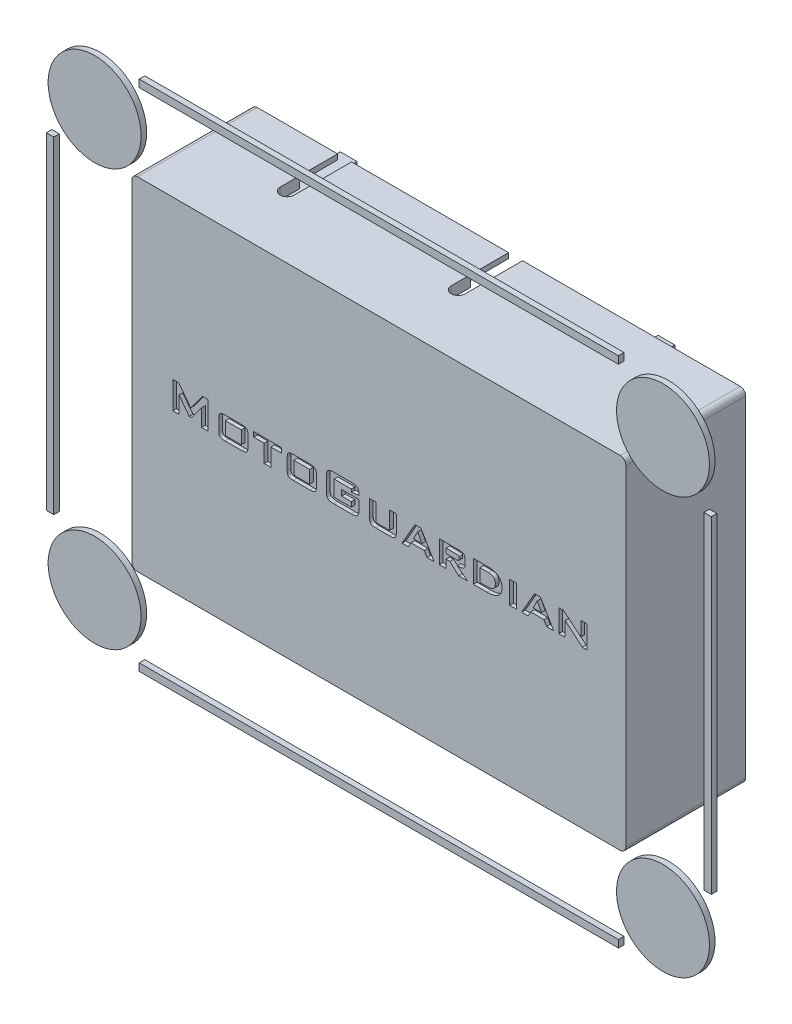
from build123d import *

# Parameters (mm, degrees)
SKETCH2_W                   = 132.9
SKETCH2_H                   = 92
BOSS_EXTRUDE1_DEPTH         = 32.25
SHELL1_T                    = -3
SKETCH3_W                   = 126.9
SKETCH3_H                   = 10.2
CUT_EXTRUDE1_DEPTH          = 1.6
SKETCH4_W                   = 10.2
SKETCH4_H                   = 87.6
CUT_EXTRUDE2_DEPTH          = 1.6
SKETCH5_W                   = 128.5
SKETCH5_H                   = 10.2
CUT_EXTRUDE3_DEPTH          = 1.6
SKETCH6_W                   = 10.2
SKETCH6_H                   = 89.2
CUT_EXTRUDE4_DEPTH          = 1.6
FILLET1_R                   = 1.5
BOSS_EXTRUDE2_DEPTH         = 19.05
BOSS_EXTRUDE3_DEPTH         = 19.05
FILLET2_R                   = 1.5
BOSS_EXTRUDE4_DEPTH         = 38.1
CUT_EXTRUDE6_DEPTH          = 3
BOSS_EXTRUDE5_DEPTH         = 16.7
BOSS_EXTRUDE6_DEPTH         = 3
SKETCH17_W                  = 15.8
SKETCH17_H                  = 1.6
BOSS_EXTRUDE8_DEPTH         = 10.2
BOSS_EXTRUDE9_START         = -1
BOSS_EXTRUDE9_OUTLINE_W     = 4.247149979
BOSS_EXTRUDE9_OUTLINE_H     = 3.474940892
BOSS_EXTRUDE9_OUTLINE_W_2   = 4.24714998
BOSS_EXTRUDE9_OUTLINE_W_3   = 1.801821204
BOSS_EXTRUDE9_OUTLINE_H_2   = 6.048971183
BOSS_EXTRUDE9_DEPTH         = 1
BOSS_EXTRUDE9_START_2       = -1.5
BOSS_EXTRUDE9_2_OUTLINE_W   = 128.9
BOSS_EXTRUDE9_2_OUTLINE_H   = 2
BOSS_EXTRUDE9_2_OUTLINE_W_2 = 2
BOSS_EXTRUDE9_2_OUTLINE_H_2 = 88
BOSS_EXTRUDE9_2_OUTLINE_R   = 12.5
BOSS_EXTRUDE9_2_DEPTH       = 1.5


# Read off the part's stored shape, not the designer's step: Boss-Extrude9
with BuildPart() as part:
    # Sketch2 → Boss-Extrude1 (new body)
    with BuildSketch(Plane.XY):
        with Locations((25.978833398, -20.101705272)):
            Rectangle(SKETCH2_W, SKETCH2_H)
    extrude(amount=BOSS_EXTRUDE1_DEPTH)

    # Shell1
    shell1_openings = [part.faces().sort_by_distance(p)[0] for p in [
        (25.978833398, -20.101705272, 0),
    ]]
    offset(amount=SHELL1_T, openings=shell1_openings, kind=Kind.INTERSECTION)

    # Sketch3 → Cut-Extrude1 (cut)
    with BuildSketch(Plane.XZ.offset(-22.898294728)):
        with Locations((25.978833398, 5.1)):
            Rectangle(SKETCH3_W, SKETCH3_H)
    extrude(amount=-CUT_EXTRUDE1_DEPTH, mode=Mode.SUBTRACT)

    # Sketch4 → Cut-Extrude2 (cut)
    with BuildSketch(Plane(origin=(-37.471166602, 0, 0), x_dir=(0, 0, -1), z_dir=(1, 0, 0))):
        with Locations((-5.1, -19.301705272)):
            Rectangle(SKETCH4_W, SKETCH4_H)
    extrude(amount=-CUT_EXTRUDE2_DEPTH, mode=Mode.SUBTRACT)

    # Sketch5 → Cut-Extrude3 (cut)
    with BuildSketch(Plane(origin=(0, -63.101705272, 0), x_dir=(1, 0, 0), z_dir=(0, 1, 0))):
        with Locations((25.178833398, -5.1)):
            Rectangle(SKETCH5_W, SKETCH5_H)
    extrude(amount=-CUT_EXTRUDE3_DEPTH, mode=Mode.SUBTRACT)

    # Sketch6 → Cut-Extrude4 (cut)
    with BuildSketch(Plane.ZY.offset(-89.428833398)):
        with Locations((5.1, -20.101705272)):
            Rectangle(SKETCH6_W, SKETCH6_H)
    extrude(amount=-CUT_EXTRUDE4_DEPTH, mode=Mode.SUBTRACT)

    # Fillet1
    fillet1_edges = [part.edges().sort_by_distance(p)[0] for p in [
        (-37.471166602, 22.898294728, 19.725),
        (-37.471166602, -63.101705272, 19.725),
        (89.428833398, -63.101705272, 19.725),
        (89.428833398, 22.898294728, 19.725),
        (-37.471166602, -20.101705272, 29.25),
        (25.978833398, -63.101705272, 29.25),
        (25.978833398, 22.898294728, 29.25),
        (-39.071166602, 24.498294728, 5.1),
        (-39.071166602, -64.701705272, 5.1),
        (91.028833398, 24.498294728, 5.1),
        (91.028833398, -64.701705272, 5.1),
        (-40.471166602, 25.898294728, 16.125),
        (92.428833398, 25.898294728, 16.125),
        (92.428833398, -66.101705272, 16.125),
        (-40.471166602, -66.101705272, 16.125),
    ]]
    fillet(fillet1_edges, radius=FILLET1_R)

    # Sketch7 → Boss-Extrude2 (add)
    with BuildSketch(Plane(origin=(0, 0, 29.25), x_dir=(-1, 0, 0), z_dir=(0, 0, -1))):
        with BuildLine():
            Line((20.971166602, 14.898294728), (20.971166602, 22.898294728))
            Line((20.971166602, 22.898294728), (28.471166602, 22.898294728))
            Line((28.471166602, 22.898294728), (28.471166602, 17.898294728))
            ThreePointArc((28.471166602, 17.898294728), (28.91050643, 16.837634557), (29.971166602, 16.398294728))
            Line((29.971166602, 16.398294728), (40.471166602, 16.398294728))
            Line((40.471166602, 16.398294728), (40.471166602, 13.398294728))
            Line((40.471166602, 13.398294728), (35.971166602, 13.398294728))
            Line((35.971166602, 13.398294728), (22.471166602, 13.398294728))
            ThreePointArc((22.471166602, 13.398294728), (21.41050643, 13.837634557), (20.971166602, 14.898294728))
        make_face()
        with BuildLine():
            Line((-68.178833398, 22.898294728), (-68.178833398, 13.398294728))
            Line((-68.178833398, 13.398294728), (-61.528833398, 13.398294728))
            ThreePointArc((-61.528833398, 13.398294728), (-60.468173226, 13.837634557), (-60.028833398, 14.898294728))
            Line((-60.028833398, 14.898294728), (-60.028833398, 22.898294728))
            Line((-60.028833398, 22.898294728), (-68.178833398, 22.898294728))
        make_face()
        with BuildLine():
            Line((20.971166602, -49.101705272), (20.971166602, -63.101705272))
            Line((20.971166602, -63.101705272), (28.471166602, -63.101705272))
            Line((28.471166602, -63.101705272), (28.471166602, -52.101705272))
            ThreePointArc((28.471166602, -52.101705272), (28.91050643, -51.0410451), (29.971166602, -50.601705272))
            Line((29.971166602, -50.601705272), (37.471166602, -50.601705272))
            Line((37.471166602, -50.601705272), (37.471166602, -47.601705272))
            Line((37.471166602, -47.601705272), (22.471166602, -47.601705272))
            ThreePointArc((22.471166602, -47.601705272), (21.41050643, -48.0410451), (20.971166602, -49.101705272))
        make_face()
        with BuildLine():
            Line((-61.528833398, -47.601705272), (-68.178833398, -47.601705272))
            Line((-68.178833398, -47.601705272), (-68.178833398, -63.101705272))
            Line((-68.178833398, -63.101705272), (-60.028833398, -63.101705272))
            Line((-60.028833398, -63.101705272), (-60.028833398, -49.101705272))
            ThreePointArc((-60.028833398, -49.101705272), (-60.468173226, -48.0410451), (-61.528833398, -47.601705272))
        make_face()
    extrude(amount=BOSS_EXTRUDE2_DEPTH)

    # Sketch8 → Boss-Extrude3 (add)
    with BuildSketch(Plane(origin=(0, 0, 29.25), x_dir=(-1, 0, 0), z_dir=(0, 0, -1))):
        Polygon((-89.428833398, 15.468294728), (-70.178833398, 15.468294728), (-70.178833398, -55.671705272), (-89.428833398, -55.671705272), (-89.428833398, -63.101705272), (-68.178833398, -63.101705272), (-68.178833398, 22.898294728), (-89.428833398, 22.898294728), align=None)
    extrude(amount=BOSS_EXTRUDE3_DEPTH)

    # Fillet2
    fillet2_edges = [part.edges().sort_by_distance(p)[0] for p in [
        (-37.031826774, 13.398294728, 28.810660172),
        (-37.031826774, 16.398294728, 28.810660172),
        (-28.471166602, 22.4589549, 28.810660172),
        (-20.971166602, 22.4589549, 28.810660172),
        (-20.971166602, 22.898294728, 18.975),
        (-20.971166602, 18.148294728, 29.25),
        (-28.471166602, 22.898294728, 18.975),
        (-28.471166602, 19.648294728, 29.25),
        (-37.471166602, 16.398294728, 18.975),
        (-37.471166602, 13.398294728, 18.975),
        (-28.91050643, 16.837634557, 29.25),
        (-32.971166602, 16.398294728, 29.25),
        (-29.221166602, 13.398294728, 29.25),
        (-21.41050643, 13.837634557, 29.25),
        (60.028833398, 18.148294728, 29.25),
        (60.028833398, 22.4589549, 28.810660172),
        (60.028833398, 22.898294728, 18.975),
        (60.468173226, 13.837634557, 29.25),
        (68.178833398, 13.398294728, 19.725),
        (64.853833398, 13.398294728, 29.25),
        (-20.971166602, -62.662365443, 28.810660172),
        (-28.471166602, -62.662365443, 28.810660172),
        (-37.471166602, -47.601705272, 18.975),
        (-37.031826774, -47.601705272, 28.810660172),
        (-29.221166602, -47.601705272, 29.25),
        (-37.471166602, -50.601705272, 18.975),
        (-32.971166602, -50.601705272, 29.25),
        (-37.031826774, -50.601705272, 28.810660172),
        (-28.471166602, -63.101705272, 18.975),
        (-28.471166602, -56.851705272, 29.25),
        (-20.971166602, -63.101705272, 18.975),
        (-20.971166602, -55.351705272, 29.25),
        (-28.91050643, -51.0410451, 29.25),
        (-21.41050643, -48.0410451, 29.25),
        (60.028833398, -63.101705272, 18.975),
        (60.028833398, -62.662365443, 28.810660172),
        (60.028833398, -55.351705272, 29.25),
        (68.178833398, -47.601705272, 19.725),
        (64.853833398, -47.601705272, 29.25),
        (60.468173226, -48.0410451, 29.25),
        (68.178833398, -17.101705272, 29.25),
    ]]
    fillet(fillet2_edges, radius=FILLET2_R)

    # Sketch11 → Boss-Extrude4 (add)
    with BuildSketch(Plane(origin=(0, 0, 29.25), x_dir=(-1, 0, 0), z_dir=(0, 0, -1))):
        with BuildLine():
            Line((25.471166602, 17.898294728), (20.971166602, 17.898294728))
            Line((20.971166602, 17.898294728), (20.971166602, 14.898294728))
            ThreePointArc((20.971166602, 14.898294728), (21.41050643, 13.837634557), (22.471166602, 13.398294728))
            Line((22.471166602, 13.398294728), (25.471166602, 13.398294728))
            Line((25.471166602, 13.398294728), (25.471166602, 17.898294728))
        make_face()
        with BuildLine():
            Line((-64.528833398, 17.898294728), (-64.528833398, 13.398294728))
            Line((-64.528833398, 13.398294728), (-61.528833398, 13.398294728))
            ThreePointArc((-61.528833398, 13.398294728), (-60.468173226, 13.837634557), (-60.028833398, 14.898294728))
            Line((-60.028833398, 14.898294728), (-60.028833398, 17.898294728))
            Line((-60.028833398, 17.898294728), (-64.528833398, 17.898294728))
        make_face()
        with BuildLine():
            Line((-64.528833398, -52.101705272), (-64.528833398, -47.601705272))
            Line((-64.528833398, -47.601705272), (-61.528833398, -47.601705272))
            ThreePointArc((-61.528833398, -47.601705272), (-60.468173226, -48.0410451), (-60.028833398, -49.101705272))
            Line((-60.028833398, -49.101705272), (-60.028833398, -52.101705272))
            Line((-60.028833398, -52.101705272), (-64.528833398, -52.101705272))
        make_face()
        with BuildLine():
            Line((25.471166602, -52.101705272), (20.971166602, -52.101705272))
            Line((20.971166602, -52.101705272), (20.971166602, -49.101705272))
            ThreePointArc((20.971166602, -49.101705272), (21.41050643, -48.0410451), (22.471166602, -47.601705272))
            Line((22.471166602, -47.601705272), (25.471166602, -47.601705272))
            Line((25.471166602, -47.601705272), (25.471166602, -52.101705272))
        make_face()
    extrude(amount=BOSS_EXTRUDE4_DEPTH)

    # Sketch13 → Cut-Extrude6 (cut)
    with BuildSketch(Plane(origin=(0, 25.898294728, 0), x_dir=(1, 0, 0), z_dir=(0, 1, 0))):
        with BuildLine():
            Line((32.403833398, -15.45), (32.403833398, 0))
            Line((32.403833398, 0), (28.653833398, 0))
            Line((28.653833398, 0), (28.653833398, -15.45))
            ThreePointArc((28.653833398, -15.45), (30.528833398, -17.325), (32.403833398, -15.45))
        make_face()
        with BuildLine():
            Line((-13.596166602, -15.45), (-13.596166602, 0))
            Line((-13.596166602, 0), (-17.346166602, 0))
            Line((-17.346166602, 0), (-17.346166602, -15.45))
            ThreePointArc((-17.346166602, -15.45), (-15.471166602, -17.325), (-13.596166602, -15.45))
        make_face()
    extrude(amount=-CUT_EXTRUDE6_DEPTH, mode=Mode.SUBTRACT)

    # Sketch14 → Boss-Extrude5 (add)
    with BuildSketch(Plane(origin=(0, 0, 10.2), x_dir=(-1, 0, 0), z_dir=(0, 0, -1))):
        Polygon((40.471166602, -1.651705272), (39.671166602, -1.651705272), (39.671166602, -4.151705272), (37.471166602, -4.151705272), (37.471166602, -24.851705272), (39.671166602, -24.851705272), (39.671166602, -27.351705272), (40.471166602, -27.351705272), align=None)
    extrude(amount=BOSS_EXTRUDE5_DEPTH)

    # Sketch16 → Boss-Extrude6 (add)
    with BuildSketch(Plane.XZ.offset(66.101705272)):
        with BuildLine():
            Line((11.628833398, 0), (11.628833398, -10.75))
            ThreePointArc((11.628833398, -10.75), (19.528833398, -4.995584412), (27.428833398, -10.75))
            Line((27.428833398, -10.75), (27.428833398, 0))
            Line((27.428833398, 0), (11.628833398, 0))
        make_face()
    extrude(amount=-BOSS_EXTRUDE6_DEPTH)

    # Sketch17 → Boss-Extrude8 (add)
    with BuildSketch(Plane.XY):
        with Locations((19.528833398, -63.901705272)):
            Rectangle(SKETCH17_W, SKETCH17_H)
    extrude(amount=BOSS_EXTRUDE8_DEPTH)

    # Boss-Extrude9 outline → Boss-Extrude9 (cut)
    # profile 1 of 12: a face of its own
    with BuildSketch(Plane.XY.offset(32.25).offset(BOSS_EXTRUDE9_START)):
        with BuildLine():
            add(Edge.make_bspline(
                [(55.419304846, -17.817734089), (55.564187564, -17.819719196), (55.845775584, -17.823577368), (56.254896607, -17.862866356), (56.638055713, -17.924319455), (56.995752173, -18.009819583), (57.327740317, -18.122771472), (57.633929717, -18.260884826), (57.913682414, -18.424731485), (58.166216605, -18.611917053), (58.39028949, -18.822264078), (58.586794495, -19.051287425), (58.750248117, -19.301650396), (58.88669006, -19.568739374), (58.991196022, -19.85594694), (59.06440289, -20.161628599), (59.113125189, -20.485391637), (59.11732149, -20.707970005), (59.119473389, -20.822110069)],
                knots=[0, 0, 0, 0, 0.080440565, 0.156340933, 0.228006814, 0.295814508, 0.360327324, 0.422469062, 0.482037507, 0.540037047, 0.59666194, 0.652383895, 0.707209527, 0.762316277, 0.818611036, 0.876486195, 0.93666108, 1, 1, 1, 1], degree=3))
            Line((55.419304846, -17.817734089), (51.397382517, -17.817734089))
            Line((51.397382517, -17.817734089), (51.397382517, -23.866705272))
            Line((51.397382517, -23.866705272), (55.06336472, -23.866705272))
            add(Edge.make_bspline(
                [(59.119473389, -20.822110069), (59.116310488, -20.942229197), (59.110154352, -21.176023967), (59.064525611, -21.516238425), (58.983193962, -21.833405506), (58.873357279, -22.129951022), (58.728279512, -22.403023715), (58.556015992, -22.657585866), (58.345060629, -22.884836518), (58.107411644, -23.094197022), (57.835511267, -23.276569704), (57.533664063, -23.437507246), (57.197755428, -23.567514106), (56.832640621, -23.67973009), (56.434405891, -23.761654368), (56.006180282, -23.824510531), (55.54526055, -23.860210027), (55.227653287, -23.864490904), (55.06336472, -23.866705272)],
                knots=[0, 0, 0, 0, 0.062443428, 0.121537237, 0.177999305, 0.232370592, 0.28552769, 0.338404165, 0.391689055, 0.446274359, 0.502723519, 0.561496872, 0.623752327, 0.689678366, 0.759875432, 0.834887571, 0.914592368, 1, 1, 1, 1], degree=3))
        make_face()
        with BuildLine():
            add(Edge.make_bspline(
                [(57.317652185, -20.777868923), (57.315846683, -20.708786793), (57.312367971, -20.575684365), (57.293086074, -20.382361922), (57.256779992, -20.203360989), (57.206862369, -20.037437725), (57.142429031, -19.885517398), (57.063343699, -19.74669618), (56.96913169, -19.622531213), (56.860413856, -19.51161244), (56.737350273, -19.415085068), (56.598179898, -19.331446597), (56.442594152, -19.261878822), (56.271144345, -19.203107458), (56.083583594, -19.160121951), (55.880707418, -19.127984722), (55.661713622, -19.107388071), (55.509845925, -19.105648257), (55.431370613, -19.104749234)],
                knots=[0, 0, 0, 0, 0.071419068, 0.137605069, 0.200518742, 0.259915649, 0.316412973, 0.370726831, 0.424632575, 0.477057456, 0.530838377, 0.585854788, 0.644458372, 0.706685365, 0.772900374, 0.843068312, 0.918907948, 1, 1, 1, 1], degree=3))
            add(Edge.make_bspline(
                [(54.761720545, -22.579690126), (54.877719708, -22.578807553), (55.101194506, -22.577107257), (55.421929435, -22.556600461), (55.715281661, -22.525004899), (55.980060156, -22.481736589), (56.217808793, -22.426148303), (56.42678759, -22.356697047), (56.609002917, -22.274327324), (56.76420377, -22.177162176), (56.897293349, -22.063406879), (57.009197464, -21.931294838), (57.107822622, -21.784014765), (57.183335684, -21.61618098), (57.243668232, -21.432102787), (57.287648604, -21.230049194), (57.313897489, -21.009826129), (57.316370606, -20.857042195), (57.317652185, -20.777868923)],
                knots=[0, 0, 0, 0, 0.095863083, 0.184682223, 0.265505419, 0.33964729, 0.406300226, 0.467095704, 0.52138583, 0.571187704, 0.617940813, 0.665475256, 0.713879967, 0.763952304, 0.817038914, 0.873767703, 0.934585897, 1, 1, 1, 1], degree=3))
            Line((54.761720545, -22.579690126), (53.199203721, -22.579690126))
            Line((53.199203721, -22.579690126), (53.199203721, -19.104749234))
            Line((53.199203721, -19.104749234), (55.431370613, -19.104749234))
        make_face(mode=Mode.SUBTRACT)
    # profile 2 of 12: a face of its own
    with BuildSketch(Plane.XY.offset(32.25).offset(BOSS_EXTRUDE9_START)):
        with BuildLine():
            add(Edge.make_bspline(
                [(47.624819373, -17.817734089), (47.691194564, -17.819231388), (47.820069894, -17.822138574), (48.006349729, -17.834752575), (48.17833746, -17.861261863), (48.336317185, -17.897451546), (48.480867254, -17.942523958), (48.611267109, -17.999878986), (48.728301502, -18.065042918), (48.830601669, -18.142916617), (48.918760964, -18.230656977), (48.999882034, -18.324686156), (49.061636323, -18.432768184), (49.119207266, -18.546109841), (49.156951976, -18.671742421), (49.188199169, -18.805182066), (49.20619229, -18.948752654), (49.208346763, -19.047724826), (49.20945677, -19.098716351)],
                knots=[0, 0, 0, 0, 0.08535066, 0.16571846, 0.239817418, 0.308799077, 0.373932588, 0.434130619, 0.491634708, 0.545752596, 0.598768396, 0.651397599, 0.704748504, 0.758321647, 0.814460052, 0.872784753, 0.93445734, 1, 1, 1, 1], degree=3))
            Line((47.624819373, -17.817734089), (42.259574986, -17.817734089))
            Line((42.259574986, -17.817734089), (42.259574986, -23.866705272))
            Line((42.259574986, -23.866705272), (44.061396189, -23.866705272))
            Line((44.061396189, -23.866705272), (44.061396189, -21.678779525))
            Line((44.061396189, -21.678779525), (45.074920616, -21.678779525))
            Line((45.074920616, -21.678779525), (47.486063052, -23.866705272))
            Line((47.486063052, -23.866705272), (49.808723197, -23.866705272))
            Line((49.808723197, -23.866705272), (47.087892742, -21.678779525))
            Line((47.087892742, -21.678779525), (47.624819373, -21.678779525))
            add(Edge.make_bspline(
                [(49.20945677, -20.411873991), (49.208408081, -20.462218443), (49.206359488, -20.560565298), (49.187370096, -20.702337123), (49.160625466, -20.835779983), (49.116737464, -20.958208981), (49.066039821, -21.074471108), (48.998327754, -21.178606236), (48.921799518, -21.274637098), (48.832325471, -21.359612074), (48.729692396, -21.435195993), (48.613832738, -21.501257447), (48.482284043, -21.555226708), (48.33870293, -21.60186985), (48.179370378, -21.634685286), (48.0077091, -21.661686652), (47.820737826, -21.674479548), (47.691863204, -21.677308061), (47.624819373, -21.678779525)],
                knots=[0, 0, 0, 0, 0.064917589, 0.126815179, 0.184321319, 0.240117567, 0.294301907, 0.34756733, 0.399840495, 0.452448862, 0.506245275, 0.56395916, 0.624035382, 0.689406524, 0.75845052, 0.833674866, 0.913473467, 1, 1, 1, 1], degree=3))
            Line((49.20945677, -20.411873991), (49.20945677, -19.098716351))
        make_face()
        with BuildLine():
            add(Edge.make_bspline(
                [(47.536337081, -19.42650302), (47.535286515, -19.398934651), (47.533312416, -19.347131488), (47.516308027, -19.275879244), (47.484832844, -19.21835691), (47.439183871, -19.172031646), (47.371699787, -19.139578929), (47.279947358, -19.11952563), (47.161363598, -19.105798282), (47.072526372, -19.105122085), (47.023541984, -19.104749234)],
                knots=[0, 0, 0, 0, 0.117283623, 0.220385272, 0.308503998, 0.393232264, 0.492758897, 0.622152012, 0.791656568, 1, 1, 1, 1], degree=3))
            Line((47.536337081, -19.42650302), (47.536337081, -20.070010593))
            add(Edge.make_bspline(
                [(47.023541984, -20.391764379), (47.072507057, -20.391311126), (47.161975163, -20.390482951), (47.281428153, -20.377464414), (47.373126145, -20.356273731), (47.441411174, -20.326648629), (47.487797026, -20.280254785), (47.514821593, -20.22096513), (47.534065932, -20.150307502), (47.535536049, -20.098331251), (47.536337081, -20.070010593)],
                knots=[0, 0, 0, 0, 0.207754382, 0.379605093, 0.508632374, 0.606605451, 0.691094164, 0.780153087, 0.880210495, 1, 1, 1, 1], degree=3))
            Line((47.023541984, -20.391764379), (44.061396189, -20.391764379))
            Line((44.061396189, -20.391764379), (44.061396189, -19.104749234))
            Line((44.061396189, -19.104749234), (47.023541984, -19.104749234))
        make_face(mode=Mode.SUBTRACT)
    # profile 3 of 12: a face of its own
    with BuildSketch(Plane.XY.offset(32.25).offset(BOSS_EXTRUDE9_START)):
        with BuildLine():
            add(Edge.make_bspline(
                [(30.676438678, -22.416802272), (30.675413524, -22.47920093), (30.673424737, -22.600253525), (30.65447458, -22.774149364), (30.627997555, -22.935590426), (30.584689728, -23.081789105), (30.533915158, -23.216682853), (30.466391506, -23.335284733), (30.389980055, -23.441657522), (30.299565568, -23.53434453), (30.192343564, -23.614187834), (30.066108544, -23.682183774), (29.921135787, -23.740389985), (29.755499616, -23.785521398), (29.571681864, -23.823965713), (29.366598828, -23.849661338), (29.142240649, -23.862406032), (28.985904994, -23.865236521), (28.904781892, -23.866705272)],
                knots=[0, 0, 0, 0, 0.070006031, 0.135810802, 0.196173469, 0.253323251, 0.306693224, 0.357554208, 0.406010039, 0.453361031, 0.50226454, 0.555464545, 0.613863515, 0.677213977, 0.74789194, 0.824507334, 0.908936261, 1, 1, 1, 1], degree=3))
            Line((30.676438678, -22.416802272), (30.676438678, -17.817734089))
            Line((30.676438678, -17.817734089), (28.874617475, -17.817734089))
            Line((28.874617475, -17.817734089), (28.874617475, -22.579690126))
            Line((28.874617475, -22.579690126), (25.270975068, -22.579690126))
            Line((25.270975068, -22.579690126), (25.270975068, -17.817734089))
            Line((25.270975068, -17.817734089), (23.469153864, -17.817734089))
            Line((23.469153864, -17.817734089), (23.469153864, -22.416802272))
            add(Edge.make_bspline(
                [(25.112109136, -23.866705272), (25.03699137, -23.866408463), (24.892595074, -23.865837917), (24.685320597, -23.848352752), (24.495747857, -23.825557569), (24.324138442, -23.791817402), (24.171528349, -23.74778783), (24.035747726, -23.696002027), (23.919673889, -23.631988481), (23.818922886, -23.558035984), (23.735124786, -23.468737693), (23.662166741, -23.365484344), (23.601798503, -23.245391713), (23.554606153, -23.109822763), (23.516103394, -22.959163377), (23.488447824, -22.793045268), (23.472753178, -22.610155273), (23.470389784, -22.483195118), (23.469153864, -22.416802272)],
                knots=[0, 0, 0, 0, 0.087360816, 0.16793069, 0.24183463, 0.309437483, 0.371141949, 0.426464187, 0.478125179, 0.524918156, 0.571253968, 0.619938907, 0.671558676, 0.72706202, 0.786645282, 0.852289935, 0.922756147, 1, 1, 1, 1], degree=3))
            Line((25.112109136, -23.866705272), (28.904781892, -23.866705272))
        make_face()
    # profile 4 of 12: a face of its own
    with BuildSketch(Plane.XY.offset(32.25).offset(BOSS_EXTRUDE9_START)):
        with BuildLine():
            add(Edge.make_bspline(
                [(20.637720545, -22.115158097), (20.637051151, -22.192312267), (20.635761649, -22.340940036), (20.612254687, -22.555189876), (20.578724669, -22.752118058), (20.534150853, -22.932922292), (20.470810522, -23.094082735), (20.397136125, -23.238980824), (20.307205151, -23.365123711), (20.203617223, -23.476389792), (20.078925875, -23.570720405), (19.932821035, -23.651554024), (19.761487568, -23.71614586), (19.568275065, -23.773442845), (19.34965821, -23.813240399), (19.108258033, -23.846410946), (18.842172102, -23.863375232), (18.656942194, -23.865564298), (18.560397662, -23.866705272)],
                knots=[0, 0, 0, 0, 0.072589108, 0.139833754, 0.202594761, 0.260598268, 0.314735282, 0.365254302, 0.413226522, 0.460094626, 0.507800517, 0.559772443, 0.616719521, 0.679819017, 0.749242803, 0.825632296, 0.909117008, 1, 1, 1, 1], degree=3))
            Line((20.637720545, -22.115158097), (20.637720545, -19.490853778))
            Line((20.637720545, -19.490853778), (16.004466022, -19.490853778))
            Line((16.004466022, -19.490853778), (16.004466022, -21.035271952))
            Line((16.004466022, -21.035271952), (18.578496312, -21.035271952))
            Line((18.578496312, -21.035271952), (18.578496312, -22.322287097))
            Line((18.578496312, -22.322287097), (13.945241789, -22.322287097))
            Line((13.945241789, -22.322287097), (13.945241789, -18.075137118))
            Line((13.945241789, -18.075137118), (18.578496312, -18.075137118))
            Line((18.578496312, -18.075137118), (18.578496312, -18.847346205))
            Line((18.578496312, -18.847346205), (20.637720545, -18.529614341))
            Line((20.637720545, -18.529614341), (20.637720545, -18.280255157))
            add(Edge.make_bspline(
                [(18.560397662, -16.530718944), (18.655626551, -16.531586705), (18.838943381, -16.533257157), (19.102070579, -16.553951395), (19.341987089, -16.585085983), (19.558421623, -16.629307839), (19.752453675, -16.683995578), (19.922371682, -16.754538559), (20.070036512, -16.83690823), (20.19501692, -16.935215037), (20.300658423, -17.04803667), (20.392979869, -17.174425218), (20.469378273, -17.31884863), (20.530692431, -17.479851565), (20.57963675, -17.656894222), (20.611998345, -17.85033619), (20.635775336, -18.059805793), (20.637057424, -18.205104088), (20.637720545, -18.280255157)],
                knots=[0, 0, 0, 0, 0.090053807, 0.17335473, 0.249484459, 0.318745921, 0.382149946, 0.43984761, 0.492381203, 0.541595961, 0.589586569, 0.638160012, 0.689218955, 0.743617245, 0.800839158, 0.862654019, 0.928962021, 1, 1, 1, 1], degree=3))
            Line((18.560397662, -16.530718944), (13.794419702, -16.530718944))
            add(Edge.make_bspline(
                [(11.886017557, -18.346616875), (11.886827389, -18.264780045), (11.888390014, -18.106870292), (11.909989882, -17.880091126), (11.938241847, -17.672036426), (11.981752709, -17.483786928), (12.041295583, -17.316277633), (12.107896527, -17.165461105), (12.191191467, -17.035821293), (12.287573062, -16.923341251), (12.403781181, -16.829094142), (12.539776754, -16.749143322), (12.696449362, -16.680731914), (12.874268206, -16.624319241), (13.07475483, -16.584126274), (13.295436006, -16.551185164), (13.538086892, -16.534012392), (13.706585236, -16.53184747), (13.794419702, -16.530718944)],
                knots=[0, 0, 0, 0, 0.07909891, 0.15262675, 0.220091019, 0.282033149, 0.339019278, 0.391803201, 0.441067305, 0.487468198, 0.534440491, 0.585017413, 0.639574269, 0.699429622, 0.765024782, 0.837072189, 0.915069329, 1, 1, 1, 1], degree=3))
            Line((11.886017557, -18.346616875), (11.886017557, -22.115158097))
            add(Edge.make_bspline(
                [(13.794419702, -23.866705272), (13.706561208, -23.865741804), (13.53801677, -23.863893523), (13.295862618, -23.844563701), (13.074300032, -23.818939375), (12.875019722, -23.775745574), (12.696643277, -23.724938253), (12.540041929, -23.660252473), (12.404084544, -23.584446508), (12.287707868, -23.494399156), (12.19183986, -23.386179171), (12.107865428, -23.262423335), (12.040815917, -23.116944563), (11.982127448, -22.954490354), (11.938122562, -22.771724211), (11.909986439, -22.569631196), (11.88837324, -22.348886323), (11.886822125, -22.194986398), (11.886017557, -22.115158097)],
                knots=[0, 0, 0, 0, 0.08629437, 0.16554388, 0.238570171, 0.305218566, 0.365648672, 0.420562716, 0.471289168, 0.51819069, 0.564351211, 0.612754469, 0.664597223, 0.721256608, 0.782272388, 0.848865447, 0.921606106, 1, 1, 1, 1], degree=3))
            Line((13.794419702, -23.866705272), (18.560397662, -23.866705272))
        make_face()
    # profile 5 of 12: a face of its own
    with BuildSketch(Plane.XY.offset(32.25).offset(BOSS_EXTRUDE9_START)):
        with BuildLine():
            add(Edge.make_bspline(
                [(1.332493366, -19.285735739), (1.333660871, -19.218662981), (1.335894423, -19.09034616), (1.352493791, -18.905688779), (1.377053971, -18.737233873), (1.415424972, -18.584251131), (1.465409508, -18.448417216), (1.524012888, -18.326935421), (1.593608909, -18.221277239), (1.679018554, -18.132692252), (1.777837047, -18.056646333), (1.893940941, -17.992367961), (2.028683331, -17.938593895), (2.18050916, -17.892409215), (2.351704929, -17.858804224), (2.541274451, -17.835968607), (2.749238981, -17.818675879), (2.894299994, -17.818055391), (2.969415754, -17.817734089)],
                knots=[0, 0, 0, 0, 0.07770302, 0.148653563, 0.214671429, 0.274762634, 0.331033142, 0.382093627, 0.430777326, 0.476922885, 0.523993841, 0.574764055, 0.630148529, 0.691820113, 0.758383966, 0.831984459, 0.912997885, 1, 1, 1, 1], degree=3))
            Line((1.332493366, -19.285735739), (1.332493366, -22.438922845))
            add(Edge.make_bspline(
                [(2.969415754, -23.866705272), (2.894303211, -23.866365583), (2.749248409, -23.865709587), (2.541241062, -23.848661625), (2.351941372, -23.825032415), (2.180599602, -23.794121238), (2.028806511, -23.749761342), (1.894069228, -23.698091191), (1.778004355, -23.635828384), (1.679033356, -23.561924481), (1.594347726, -23.475523976), (1.523354698, -23.373448907), (1.465949952, -23.254592541), (1.415300255, -23.122438683), (1.377054614, -22.973376142), (1.352470339, -22.808936338), (1.335951032, -22.628953575), (1.33367718, -22.503984377), (1.332493366, -22.438922845)],
                knots=[0, 0, 0, 0, 0.088095524, 0.170127096, 0.244652571, 0.311901392, 0.374124794, 0.429912295, 0.480940188, 0.528126695, 0.574286206, 0.622284934, 0.673282516, 0.72878659, 0.788109537, 0.853403154, 0.92367867, 1, 1, 1, 1], degree=3))
            Line((2.969415754, -23.866705272), (7.417661849, -23.866705272))
            add(Edge.make_bspline(
                [(9.183285752, -22.438922845), (9.182269973, -22.501317125), (9.180310234, -22.621694271), (9.161395296, -22.794990547), (9.134197032, -22.954620615), (9.094836338, -23.100851524), (9.039813599, -23.23180462), (8.975456255, -23.34933682), (8.900876635, -23.454436925), (8.81039349, -23.54367656), (8.704944972, -23.622969714), (8.579221143, -23.687519254), (8.434883489, -23.745256642), (8.269447969, -23.786807164), (8.085100766, -23.823948467), (7.880804627, -23.849491538), (7.65579718, -23.862524235), (7.499456845, -23.865269164), (7.417661849, -23.866705272)],
                knots=[0, 0, 0, 0, 0.070478488, 0.13597399, 0.196744033, 0.253344562, 0.306656662, 0.356830935, 0.404555617, 0.451687573, 0.499860945, 0.55305993, 0.610868969, 0.675175514, 0.745437953, 0.823321712, 0.907564482, 1, 1, 1, 1], degree=3))
            Line((9.183285752, -22.438922845), (9.183285752, -19.285735739))
            add(Edge.make_bspline(
                [(7.417661849, -17.817734089), (7.500139209, -17.818945919), (7.658555519, -17.821273511), (7.886120217, -17.83735349), (8.093012137, -17.862848271), (8.27961534, -17.898108488), (8.444657057, -17.945908869), (8.589057503, -18.004260467), (8.713964989, -18.072111174), (8.818755112, -18.154243265), (8.90611384, -18.248886548), (8.982512954, -18.354970608), (9.043505183, -18.477174535), (9.096837511, -18.611280983), (9.133154466, -18.761180468), (9.164744699, -18.922590946), (9.179411885, -19.099795628), (9.181958719, -19.222040056), (9.183285752, -19.285735739)],
                knots=[0, 0, 0, 0, 0.092018803, 0.176742798, 0.254387427, 0.32449862, 0.388399047, 0.445758479, 0.49798832, 0.546463415, 0.593557236, 0.641288126, 0.691797544, 0.745547423, 0.801962926, 0.863572649, 0.928914279, 1, 1, 1, 1], degree=3))
            Line((7.417661849, -17.817734089), (2.969415754, -17.817734089))
        make_face()
        with Locations((5.257889559, -20.84221968)):
            Rectangle(BOSS_EXTRUDE9_OUTLINE_W, BOSS_EXTRUDE9_OUTLINE_H, mode=Mode.SUBTRACT)
    # profile 6 of 12: a face of its own
    with BuildSketch(Plane.XY.offset(32.25).offset(BOSS_EXTRUDE9_START)):
        with BuildLine():
            add(Edge.make_bspline(
                [(-17.071823212, -19.285735739), (-17.070655707, -19.218662981), (-17.068422154, -19.09034616), (-17.051822786, -18.905688779), (-17.027262607, -18.737233873), (-16.988891606, -18.584251131), (-16.938907069, -18.448417216), (-16.88030369, -18.326935421), (-16.810707668, -18.221277239), (-16.725298024, -18.132692252), (-16.626479531, -18.056646333), (-16.510375637, -17.992367961), (-16.375633247, -17.938593895), (-16.223807417, -17.892409215), (-16.052611649, -17.858804224), (-15.863042126, -17.835968607), (-15.655077596, -17.818675879), (-15.510016583, -17.818055391), (-15.434900824, -17.817734089)],
                knots=[0, 0, 0, 0, 0.07770302, 0.148653563, 0.214671429, 0.274762634, 0.331033142, 0.382093627, 0.430777326, 0.476922885, 0.523993841, 0.574764055, 0.630148529, 0.691820113, 0.758383966, 0.831984459, 0.912997885, 1, 1, 1, 1], degree=3))
            Line((-17.071823212, -19.285735739), (-17.071823212, -22.438922845))
            add(Edge.make_bspline(
                [(-15.434900824, -23.866705272), (-15.510013367, -23.866365583), (-15.655068169, -23.865709587), (-15.863075515, -23.848661625), (-16.052375205, -23.825032415), (-16.223716975, -23.794121238), (-16.375510066, -23.749761342), (-16.510247349, -23.698091191), (-16.626312222, -23.635828384), (-16.725283222, -23.561924481), (-16.809968851, -23.475523976), (-16.88096188, -23.373448907), (-16.938366625, -23.254592541), (-16.989016323, -23.122438683), (-17.027261963, -22.973376142), (-17.051846239, -22.808936338), (-17.068365546, -22.628953575), (-17.070639398, -22.503984377), (-17.071823212, -22.438922845)],
                knots=[0, 0, 0, 0, 0.088095524, 0.170127096, 0.244652571, 0.311901392, 0.374124794, 0.429912295, 0.480940188, 0.528126695, 0.574286206, 0.622284934, 0.673282516, 0.72878659, 0.788109537, 0.853403154, 0.92367867, 1, 1, 1, 1], degree=3))
            Line((-15.434900824, -23.866705272), (-10.986654728, -23.866705272))
            add(Edge.make_bspline(
                [(-9.221030826, -22.438922845), (-9.222046604, -22.501317125), (-9.224006343, -22.621694271), (-9.242921282, -22.794990547), (-9.270119546, -22.954620615), (-9.309480239, -23.100851524), (-9.364502978, -23.23180462), (-9.428860323, -23.34933682), (-9.503439943, -23.454436925), (-9.593923088, -23.54367656), (-9.699371605, -23.622969714), (-9.825095434, -23.687519254), (-9.969433088, -23.745256642), (-10.134868609, -23.786807164), (-10.319215812, -23.823948467), (-10.52351195, -23.849491538), (-10.748519398, -23.862524235), (-10.904859732, -23.865269164), (-10.986654728, -23.866705272)],
                knots=[0, 0, 0, 0, 0.070478488, 0.13597399, 0.196744033, 0.253344562, 0.306656662, 0.356830935, 0.404555617, 0.451687573, 0.499860945, 0.55305993, 0.610868969, 0.675175514, 0.745437953, 0.823321712, 0.907564482, 1, 1, 1, 1], degree=3))
            Line((-9.221030826, -22.438922845), (-9.221030826, -19.285735739))
            add(Edge.make_bspline(
                [(-10.986654728, -17.817734089), (-10.904177369, -17.818945919), (-10.745761058, -17.821273511), (-10.518196361, -17.83735349), (-10.311304441, -17.862848271), (-10.124701238, -17.898108488), (-9.959659521, -17.945908869), (-9.815259075, -18.004260467), (-9.690351589, -18.072111174), (-9.585561465, -18.154243265), (-9.498202737, -18.248886548), (-9.421803623, -18.354970608), (-9.360811395, -18.477174535), (-9.307479067, -18.611280983), (-9.271162111, -18.761180468), (-9.239571878, -18.922590946), (-9.224904692, -19.099795628), (-9.222357858, -19.222040056), (-9.221030826, -19.285735739)],
                knots=[0, 0, 0, 0, 0.092018803, 0.176742798, 0.254387427, 0.32449862, 0.388399047, 0.445758479, 0.49798832, 0.546463415, 0.593557236, 0.641288126, 0.691797544, 0.745547423, 0.801962926, 0.863572649, 0.928914279, 1, 1, 1, 1], degree=3))
            Line((-10.986654728, -17.817734089), (-15.434900824, -17.817734089))
        make_face()
        with Locations((-13.146427019, -20.84221968)):
            Rectangle(BOSS_EXTRUDE9_OUTLINE_W_2, BOSS_EXTRUDE9_OUTLINE_H, mode=Mode.SUBTRACT)
    # profile 7 of 12: a face of its own
    with BuildSketch(Plane.XY.offset(32.25).offset(BOSS_EXTRUDE9_START)):
        with BuildLine():
            add(Edge.make_bspline(
                [(-21.705077735, -19.344053613), (-21.704943217, -19.33688766), (-21.704808699, -19.329721708), (-21.704670214, -19.322555959)],
                knots=[0, 0, 0, 0, 0.034298236, 0.034298236, 0.034298236, 0.034298236], degree=3))
            Line((-21.705077735, -19.344053613), (-21.705077735, -23.866705272))
            Line((-21.705077735, -23.866705272), (-19.903256532, -23.866705272))
            Line((-19.903256532, -23.866705272), (-19.903256532, -16.530718944))
            Line((-19.903256532, -16.530718944), (-21.518058347, -16.530718944))
            Line((-21.518058347, -16.530718944), (-24.606894695, -20.775857962))
            Line((-24.606894695, -20.775857962), (-27.850575054, -16.530718944))
            Line((-27.850575054, -16.530718944), (-29.427168607, -16.530718944))
            Line((-29.427168607, -16.530718944), (-29.427168607, -23.866705272))
            Line((-29.427168607, -23.866705272), (-27.754048918, -23.866705272))
            Line((-27.754048918, -23.866705272), (-27.754048911, -19.363024578))
            add(Edge.make_bspline(
                [(-27.731928345, -19.394327642), (-27.739303244, -19.383892654), (-27.746678142, -19.373457667), (-27.754048911, -19.363024578)],
                knots=[0, 0, 0, 0, 0.04362366, 0.04362366, 0.04362366, 0.04362366], degree=3))
            Line((-27.731928345, -19.394327642), (-25.007075967, -22.96579467))
            Line((-25.007075967, -22.96579467), (-24.450039725, -22.96579467))
            Line((-24.450039725, -22.96579467), (-21.704670214, -19.322555959))
        make_face()
    # profile 8 of 12: a face of its own
    with BuildSketch(Plane.XY.offset(32.25).offset(BOSS_EXTRUDE9_START)):
        Polygon((74.434953618, -23.866705272), (76.108073307, -23.866705272), (76.108073307, -19.96141869), (80.739316869, -23.866705272), (82.028342975, -23.866705272), (82.028342975, -17.817734089), (80.355223286, -17.817734089), (80.355223286, -21.662691835), (75.659628967, -17.817734089), (74.434953618, -17.817734089), align=None)
    # profile 9 of 12: a face of its own
    with BuildSketch(Plane.XY.offset(32.25).offset(BOSS_EXTRUDE9_START)):
        Polygon((64.396235485, -23.866705272), (66.113596319, -23.866705272), (66.837542338, -22.579690126), (70.384877832, -22.579690126), (71.110834813, -23.866705272), (73.019236958, -23.866705272), (69.469890503, -17.817734089), (67.867154455, -17.817734089), align=None)
        Polygon((67.507192406, -21.292674981), (68.605177202, -19.128880768), (69.761479871, -21.292674981), align=None, mode=Mode.SUBTRACT)
    # profile 10 of 12: a face of its own
    with BuildSketch(Plane.XY.offset(32.25).offset(BOSS_EXTRUDE9_START)):
        with Locations((62.079608223, -20.842219681)):
            Rectangle(BOSS_EXTRUDE9_OUTLINE_W_3, BOSS_EXTRUDE9_OUTLINE_H_2)
    # profile 11 of 12: a face of its own
    with BuildSketch(Plane.XY.offset(32.25).offset(BOSS_EXTRUDE9_START)):
        Polygon((32.220856852, -23.866705272), (33.938217687, -23.866705272), (34.662163706, -22.579690126), (38.2094992, -22.579690126), (38.935456181, -23.866705272), (40.843858326, -23.866705272), (37.29451187, -17.817734089), (35.691775822, -17.817734089), align=None)
        Polygon((37.586101239, -21.292674981), (35.331813774, -21.292674981), (36.42979857, -19.128880768), align=None, mode=Mode.SUBTRACT)
    # profile 12 of 12: a face of its own
    with BuildSketch(Plane.XY.offset(32.25).offset(BOSS_EXTRUDE9_START)):
        Polygon((-4.845179332, -23.866705272), (-3.043358128, -23.866705272), (-3.043358128, -19.104749234), (-0.211924809, -19.104749234), (-0.211924809, -17.817734089), (-7.676612651, -17.817734089), (-7.676612651, -19.104749234), (-4.845179332, -19.104749234), align=None)
    extrude(amount=BOSS_EXTRUDE9_DEPTH, mode=Mode.SUBTRACT)


with BuildPart() as body_2:
    # Boss-Extrude9 2 outline → Boss-Extrude9 2 (new body)
    with BuildSketch(Plane.XY.offset(32.25).offset(BOSS_EXTRUDE9_START_2)):
        with Locations((25.978833398, 47.898294728)):
            Rectangle(BOSS_EXTRUDE9_2_OUTLINE_W, BOSS_EXTRUDE9_2_OUTLINE_H)
        with Locations((25.978833398, -88.101705272)):
            Rectangle(BOSS_EXTRUDE9_2_OUTLINE_W, BOSS_EXTRUDE9_2_OUTLINE_H)
        with Locations((114.428833398, -20.101705272)):
            Rectangle(BOSS_EXTRUDE9_2_OUTLINE_W_2, BOSS_EXTRUDE9_2_OUTLINE_H_2)
        with Locations((-62.471166602, -20.101705272)):
            Rectangle(BOSS_EXTRUDE9_2_OUTLINE_W_2, BOSS_EXTRUDE9_2_OUTLINE_H_2)
        with Locations((102.428833398, -76.101705272)):
            Circle(BOSS_EXTRUDE9_2_OUTLINE_R)
        with Locations((102.428833398, 35.898294728)):
            Circle(BOSS_EXTRUDE9_2_OUTLINE_R)
        with Locations((-50.471166602, -76.101705272)):
            Circle(BOSS_EXTRUDE9_2_OUTLINE_R)
        with Locations((-50.471166602, 35.898294728)):
            Circle(BOSS_EXTRUDE9_2_OUTLINE_R)
    extrude(amount=BOSS_EXTRUDE9_2_DEPTH)


solid = Compound([part.part, body_2.part])
